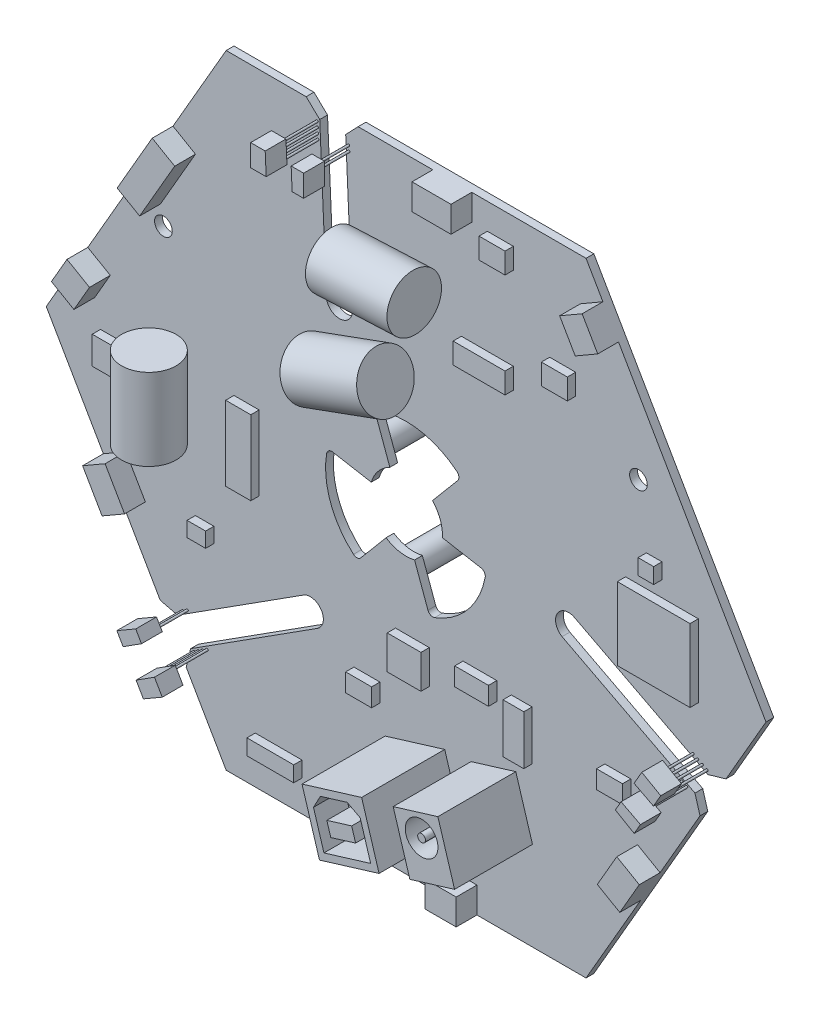
from build123d import *

# Parameters (mm, degrees)
ESQUISSE1_R                  = 1.7
BOSS_EXTRU_1_DEPTH           = 1.5
ESQUISSE2_R                  = 2.5
BOSS_EXTRU_2_DEPTH           = 10
R_P_TITION_CIRCULAIRE1_COUNT = 3
ESQUISSE4_W                  = 6
ESQUISSE4_H                  = 5
ESQUISSE4_W_2                = 7.5
BOSS_EXTRU_3_DEPTH           = 4
ESQUISSE5_R                  = 0.2
BOSS_EXTRU_4_DEPTH           = 6.5
BOSS_EXTRU_5_DEPTH           = 4
BOSS_EXTRU_6_DEPTH           = 4
R_P_TITION_CIRCULAIRE2_COUNT = 3
ESQUISSE8_R                  = 5.25
BOSS_EXTRU_7_DEPTH           = 7.85
ESQUISSE9_R                  = 5.25
BOSS_EXTRU_8_DEPTH           = 15.7
BOSS_EXTRU_9_DEPTH           = 10.7
BOSS_EXTRU_9_DEPTH_BACK      = 5
ESQUISSE10_R                 = 5.25
ESQUISSE11_W                 = 5
ESQUISSE11_H                 = 4
ESQUISSE11_W_2               = 10
ESQUISSE11_W_3               = 14
ESQUISSE11_H_2               = 14
ESQUISSE11_W_4               = 3
ESQUISSE11_H_3               = 3
ESQUISSE11_W_5               = 3.836637452
ESQUISSE11_H_4               = 5.337930368
ESQUISSE11_W_6               = 4.837499397
ESQUISSE11_H_5               = 14.345687866
ESQUISSE11_W_7               = 3.571026255
ESQUISSE11_H_6               = 2.884290436
ESQUISSE11_W_8               = 6.5
ESQUISSE11_H_7               = 6.5
ESQUISSE11_H_8               = 3.5
ESQUISSE11_W_9               = 4
ESQUISSE11_H_9               = 9.5
ESQUISSE11_W_10              = 9
BOSS_EXTRU_10_DEPTH          = 1.6
BOSS_EXTRU_11_DEPTH          = 16
ENL_V_MAT_EXTRU_1_DEPTH      = 6
ESQUISSE15_R                 = 3.15
ESQUISSE15_R_2               = 0.75
BOSS_EXTRU_12_DEPTH          = 15
CONG_1_R                     = 1


# Read off the part's stored shape, not the designer's step: Dôme1
with BuildPart() as part:
    # Esquisse1 → Boss.-Extru.1 (new body)
    with BuildSketch(Plane.XY):
        with BuildLine():
            Line((-34.641016151, 60), (-19.240444944, 60))
            Line((-19.240444944, 60), (-16.628781034, 57.502495011))
            Line((-16.628781034, 57.502495011), (-15.341016151, 28.7))
            ThreePointArc((-15.341016151, 28.7), (-12.841016151, 26.2), (-10.341016151, 28.7))
            Line((-10.341016151, 28.7), (-11.628781034, 57.502495011))
            Line((-11.628781034, 57.502495011), (-9.240444944, 60))
            Line((-9.240444944, 60), (34.641016151, 60))
            Line((34.641016151, 60), (69.282032303, 0))
            Line((69.282032303, 0), (61.581746699, -13.337285898))
            Line((61.581746699, -13.337285898), (58.113011977, -14.350300696))
            Line((58.113011977, -14.350300696), (32.525437164, -1.064290293))
            ThreePointArc((32.525437164, -1.064290293), (29.110373655, -1.979353803), (30.025437164, -5.394417312))
            Line((30.025437164, -5.394417312), (55.613011977, -18.680427715))
            Line((55.613011977, -18.680427715), (56.581746699, -21.997539936))
            Line((56.581746699, -21.997539936), (34.641016151, -60))
            Line((34.641016151, -60), (-34.641016151, -60))
            Line((-34.641016151, -60), (-42.341301755, -46.662714102))
            Line((-42.341301755, -46.662714102), (-41.484230943, -43.152194315))
            Line((-41.484230943, -43.152194315), (-17.184421013, -27.635709707))
            ThreePointArc((-17.184421013, -27.635709707), (-16.269357503, -24.220646197), (-19.684421013, -23.305582688))
            Line((-19.684421013, -23.305582688), (-43.984230943, -38.822067296))
            Line((-43.984230943, -38.822067296), (-47.341301755, -38.002460064))
            Line((-47.341301755, -38.002460064), (-69.282032303, 0))
            Line((-69.282032303, 0), (-53.282032303, 27.712812921))
            Line((-53.282032303, 27.712812921), (-50.25094339, 25.962812921))
            ThreePointArc((-50.25094339, 25.962812921), (-49.363026877, 26.200729434), (-49.60094339, 27.088645946))
            Line((-49.60094339, 27.088645946), (-52.632032303, 28.838645946))
            Line((-52.632032303, 28.838645946), (-34.641016151, 60))
        make_face()
        with Locations((-46.721649396, 24.675729434)):
            Circle(ESQUISSE1_R, mode=Mode.SUBTRACT)
        with Locations((44.730633244, 28.124270566)):
            Circle(ESQUISSE1_R, mode=Mode.SUBTRACT)
        with Locations((1.991016151, -52.8)):
            Circle(ESQUISSE1_R, mode=Mode.SUBTRACT)
        with BuildLine():
            Line((-6.046000548, 14.272206465), (-3.130208503, 6.261133661))
            ThreePointArc((-3.130208503, 6.261133661), (-5.362311102, 4.499513268), (-6.709567975, 1.995419152))
            Line((-6.709567975, 1.995419152), (-15.105256556, 3.475805571))
            ThreePointArc((-15.105256556, 3.475805571), (-14.565235622, -5.301312222), (-9.337093092, -12.372093299))
            Line((-9.337093092, -12.372093299), (-3.857196555, -5.841406914))
            ThreePointArc((-3.857196555, -5.841406914), (-1.215537244, -6.893654271), (1.62670031, -6.808365891))
            Line((1.62670031, -6.808365891), (4.542492355, -14.819438694))
            ThreePointArc((4.542492355, -14.819438694), (11.873688868, -9.96320795), (15.383093641, -1.900113166))
            Line((15.383093641, -1.900113166), (6.987405059, -0.419726748))
            ThreePointArc((6.987405059, -0.419726748), (6.577848346, 2.394141003), (5.082867664, 4.812946738))
            Line((5.082867664, 4.812946738), (10.562764201, 11.343633123))
            ThreePointArc((10.562764201, 11.343633123), (2.691546754, 15.264520172), (-6.046000548, 14.272206465))
        make_face(mode=Mode.SUBTRACT)
    extrude(amount=BOSS_EXTRU_1_DEPTH)

    # Esquisse2 → Boss.-Extru.2 (add)
    with BuildSketch(Plane(origin=(0, 0, 0), x_dir=(-1, 0, 0), z_dir=(0, 0, -1))):
        with Locations(Location((8.043466653, 6.749269902, 0), (0, 0, 180))):
            Circle(ESQUISSE2_R)
    boss_extru_2 = extrude(amount=BOSS_EXTRU_2_DEPTH)

    # Dôme1 outline → Dôme1 (revolve)
    with BuildSketch(Plane(origin=(-8.043466653, 6.749269902, 0), x_dir=(1, 0, 0), z_dir=(0, -1, 0))):
        with BuildLine():
            Line((0, -9.999999997), (0, -12.5))
            ThreePointArc((0, -12.5), (1.767766954, -11.767766952), (2.5, -9.999999997))
            Line((2.5, -9.999999997), (0, -9.999999997))
        make_face()
    d_me1 = revolve(axis=Axis((-8.043466653, 6.749269902, 0), (0, 0, 1)))

    # Répétition circulaire1: Boss.-Extru.2, Dôme1 ×3 about axis
    r_p_tition_circulaire1_axis = Axis((0, 0, 0), (0, 0, 1))
    add([boss_extru_2.rotate(r_p_tition_circulaire1_axis, i * 360 / R_P_TITION_CIRCULAIRE1_COUNT) for i in range(1, R_P_TITION_CIRCULAIRE1_COUNT)])
    add([d_me1.rotate(r_p_tition_circulaire1_axis, i * 360 / R_P_TITION_CIRCULAIRE1_COUNT) for i in range(1, R_P_TITION_CIRCULAIRE1_COUNT)])

    # Esquisse4 → Boss.-Extru.3 (add)
    with BuildSketch(Plane.XY.offset(1.5)):
        Polygon((-51.632032303, 30.570696754), (-44.882032303, 42.262039705), (-40.551905284, 39.762039705), (-47.301905284, 28.070696754), align=None)
        Polygon((-61.282032303, 13.856406461), (-64.282032303, 8.660254038), (-59.951905284, 6.160254038), (-56.951905284, 11.356406461), align=None)
        Polygon((-58.282032303, -19.052558883), (-54.532032303, -25.547749412), (-50.201905284, -23.047749412), (-53.951905284, -16.552558883), align=None)
        with Locations((10.641016151, -57.5)):
            Rectangle(ESQUISSE4_W, ESQUISSE4_H)
        Polygon((45.141016151, -41.813466521), (48.891016151, -35.318275992), (44.560889132, -32.818275992), (40.810889132, -39.313466521), align=None)
        Polygon((37.891016151, 54.370834875), (40.891016151, 49.174682453), (36.560889132, 46.674682453), (33.560889132, 51.870834875), align=None)
        with Locations((8.891016151, 57.5)):
            Rectangle(ESQUISSE4_W_2, ESQUISSE4_H)
    extrude(amount=BOSS_EXTRU_3_DEPTH)

    # Esquisse5 → Boss.-Extru.4 (add)
    with BuildSketch(Plane.XY.offset(1.5)):
        with Locations((-17.106925442, 57.002495011)):
            Circle(ESQUISSE5_R)
        with Locations((-17.062259878, 56.003493015)):
            Circle(ESQUISSE5_R)
        with Locations((-17.017594314, 55.004491019)):
            Circle(ESQUISSE5_R)
        with Locations((-16.972928749, 54.005489024)):
            Circle(ESQUISSE5_R)
        with Locations((-11.061216255, 56.002495011)):
            Circle(ESQUISSE5_R)
        with Locations((-11.016550691, 55.003493015)):
            Circle(ESQUISSE5_R)
    boss_extru_4 = extrude(amount=BOSS_EXTRU_4_DEPTH)

    # Esquisse6 → Boss.-Extru.5 (add)
    with BuildSketch(Plane.XY.offset(8)):
        Polygon((-19.428781034, 57.502495011), (-16.628781034, 57.502495011), (-16.441185664, 53.306686629), (-19.428781034, 53.306686629), align=None)
    boss_extru_5 = extrude(amount=BOSS_EXTRU_5_DEPTH)

    # Esquisse7 → Boss.-Extru.6 (add)
    with BuildSketch(Plane.XY.offset(8)):
        Polygon((-11.628781034, 57.502495011), (-9.228781034, 57.502495011), (-9.228781034, 53.306686629), (-11.441185664, 53.306686629), align=None)
    boss_extru_6 = extrude(amount=BOSS_EXTRU_6_DEPTH)

    # Répétition circulaire2: Boss.-Extru.4, Boss.-Extru.5, Boss.-Extru.6 ×3 about axis
    r_p_tition_circulaire2_axis = Axis((0, 0, 0), (0, 0, 1))
    add([boss_extru_4.rotate(r_p_tition_circulaire2_axis, i * 360 / R_P_TITION_CIRCULAIRE2_COUNT) for i in range(1, R_P_TITION_CIRCULAIRE2_COUNT)])
    add([boss_extru_5.rotate(r_p_tition_circulaire2_axis, i * 360 / R_P_TITION_CIRCULAIRE2_COUNT) for i in range(1, R_P_TITION_CIRCULAIRE2_COUNT)])
    add([boss_extru_6.rotate(r_p_tition_circulaire2_axis, i * 360 / R_P_TITION_CIRCULAIRE2_COUNT) for i in range(1, R_P_TITION_CIRCULAIRE2_COUNT)])

    # Esquisse11 → Boss.-Extru.10 (add)
    with BuildSketch(Plane.XY.offset(1.5)):
        with Locations((18.141016151, 53)):
            Rectangle(ESQUISSE11_W, ESQUISSE11_H)
        with Locations((15.641016151, 33)):
            Rectangle(ESQUISSE11_W_2, ESQUISSE11_H)
        with Locations((30.141016151, 38)):
            Rectangle(ESQUISSE11_W, ESQUISSE11_H)
        with Locations((49.258983849, 3.7)):
            Rectangle(ESQUISSE11_W_3, ESQUISSE11_H_2)
        with Locations((47.758983849, 15.2)):
            Rectangle(ESQUISSE11_W_4, ESQUISSE11_H_3)
        with Locations((-56.907415893, -1.265130637)):
            Rectangle(ESQUISSE11_W_5, ESQUISSE11_H_4)
        with Locations((-30.718195022, -3.934095821)):
            Rectangle(ESQUISSE11_W_6, ESQUISSE11_H_5)
        with Locations((-38.784133526, -21.943421398)):
            Rectangle(ESQUISSE11_W_7, ESQUISSE11_H_6)
        with Locations((1.208983849, -23.25)):
            Rectangle(ESQUISSE11_W_8, ESQUISSE11_H_7)
        with Locations((14.208983849, -20.75)):
            Rectangle(ESQUISSE11_W_8, ESQUISSE11_H_8)
        with Locations((22.258983849, -24.75)):
            Rectangle(ESQUISSE11_W_9, ESQUISSE11_H_9)
        with Locations((40.758983849, -24.25)):
            Rectangle(ESQUISSE11_W, ESQUISSE11_H_8)
        with Locations((-24.541016151, -52.5)):
            Rectangle(ESQUISSE11_W_10, ESQUISSE11_H_3)
        with Locations((-7.541016151, -32.25)):
            Rectangle(ESQUISSE11_W, ESQUISSE11_H_8)
    extrude(amount=BOSS_EXTRU_10_DEPTH)

    # Esquisse12 → Boss.-Extru.11 (add)
    with BuildSketch(Plane.XY.offset(1.5)):
        Polygon((-0.678741547, -50), (10.796915524, -46.491539543), (7.43464092, -35.49403485), (-4.041016151, -39.002495306), align=None)
    extrude(amount=BOSS_EXTRU_11_DEPTH)

    # Esquisse13 → Enlèv. mat.-Extru.1 (cut)
    with BuildSketch(Plane.XY.offset(17.5)):
        Polygon((7.156271363, -39.029923761), (4.658918442, -37.702057658), (-0.505127241, -39.280864864), (-1.832993343, -41.778217785), (0.18437142, -48.376720601), (9.173636126, -45.628426577), align=None)
        Polygon((1.49883828, -45.15148001), (6.28036206, -43.689621486), (5.520195627, -41.203229121), (0.738671848, -42.665087644), align=None, mode=Mode.SUBTRACT)
    extrude(amount=-ENL_V_MAT_EXTRU_1_DEPTH, mode=Mode.SUBTRACT)

    # Esquisse15 → Boss.-Extru.12 (add)
    # profile 1 of 2: a face of its own
    with BuildSketch(Plane.XY.offset(1.5)):
        Polygon((12.508536405, -34.988481082), (21.115279208, -32.35713574), (24.33136796, -42.876488055), (15.724625157, -45.507833398), align=None)
        with Locations((17.981394625, -37.498027435)):
            Circle(ESQUISSE15_R, mode=Mode.SUBTRACT)
    # profile 2 of 2: a face of its own
    with BuildSketch(Plane.XY.offset(1.5)):
        with Locations((17.981394625, -37.498027435)):
            Circle(ESQUISSE15_R_2)
    extrude(amount=BOSS_EXTRU_12_DEPTH)

    # Congé1
    cong_1_edges = [part.edges().sort_by_distance(p)[0] for p in [
        (10.562764201, 11.343633123, 0.75),
        (-6.046000548, 14.272206465, 0.75),
        (-15.105256556, 3.475805571, 0.75),
        (-9.337093092, -12.372093299, 0.75),
        (4.542492355, -14.819438694, 0.75),
        (15.383093641, -1.900113166, 0.75),
    ]]
    fillet(cong_1_edges, radius=CONG_1_R)


with BuildPart() as body_2:
    # Esquisse8 → Boss.-Extru.7 (new, symmetric)
    with BuildSketch(Plane(origin=(0, 0, 0), x_dir=(1, 0, 0), z_dir=(0, 1, 0))):
        with Locations(Location((-44.282032303, -6.75, 0), (0, 0, 270))):
            Circle(ESQUISSE8_R)
    extrude(amount=BOSS_EXTRU_7_DEPTH, both=True)


with BuildPart() as body_3:
    # Esquisse9 → Boss.-Extru.8 (new body)
    with BuildSketch(Plane(origin=(-7.041759356, -0.314838364, 0), x_dir=(0, 0, 1), z_dir=(-0.999001995685138, -0.04466556410828597, 0))):
        with Locations(Location((6.75, 41, 0), (0, 0, 270))):
            Circle(ESQUISSE9_R)
    extrude(amount=-BOSS_EXTRU_8_DEPTH)


with BuildPart() as body_4:
    # Esquisse10 → Boss.-Extru.9 (new, two sides: drawn at the far end of the back side and taken through both)
    with BuildSketch(Plane(origin=(-0.751754097, -0.273616115, 0), x_dir=(0, 0, -1), z_dir=(0.9396926207859083, 0.34202014332566943, 0)).offset(-BOSS_EXTRU_9_DEPTH_BACK)):
        with Locations(Location((-6.75, 23.479341071, 0), (0, 0, 90))):
            Circle(ESQUISSE10_R)
    extrude(amount=BOSS_EXTRU_9_DEPTH + BOSS_EXTRU_9_DEPTH_BACK)


solid = Compound([part.part, body_2.part, body_3.part, body_4.part])
